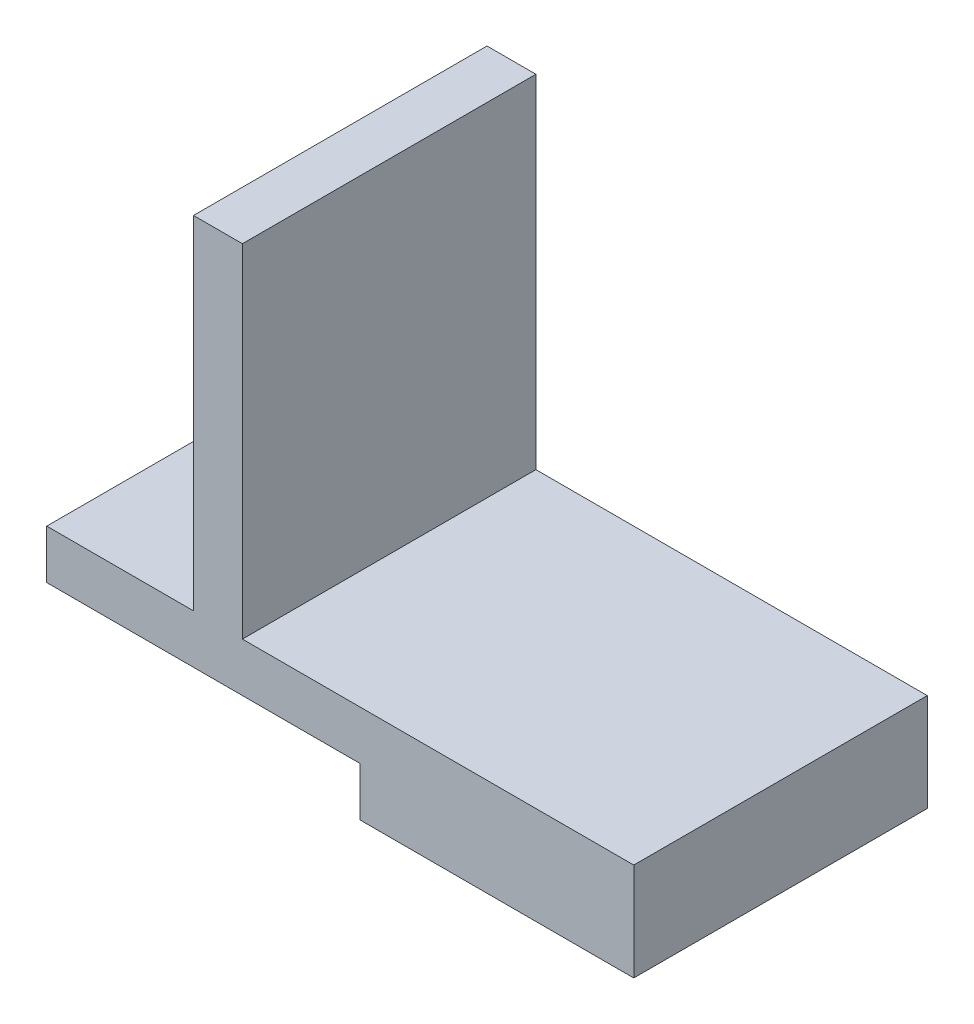
from build123d import *

# Parameters (mm, degrees)
BOSS_EXTRUDE1_DEPTH                   = 38.1
F_1_4_0_25_DIAMETER_HOLE1_D           = 6.35
F_1_4_0_25_DIAMETER_HOLE1_CSINK_D     = 7.62
F_1_4_0_25_DIAMETER_HOLE1_CSINK_ANGLE = 90


with BuildPart() as part:
    # Sketch1 → Boss-Extrude1 (new body)
    with BuildSketch(Plane.XY):
        Polygon((0, 0), (50.8, 0), (50.8, -12.7), (15.24, -12.7), (15.24, -6.35), (-25.4, -6.35), (-25.4, 0), (-6.35, 0), (-6.35, 44.45), (0, 44.45), align=None)
    extrude(amount=BOSS_EXTRUDE1_DEPTH)

    # 1/4 (0.25) Diameter Hole1 (through all)
    with Locations(Plane(origin=(0, 0, 0), x_dir=(1, 0, 0), z_dir=(0, 1, 0))):
        with Locations((-15.875, -19.05)):
            CounterSinkHole(F_1_4_0_25_DIAMETER_HOLE1_D / 2, F_1_4_0_25_DIAMETER_HOLE1_CSINK_D / 2, counter_sink_angle=F_1_4_0_25_DIAMETER_HOLE1_CSINK_ANGLE)


solid = part.part
